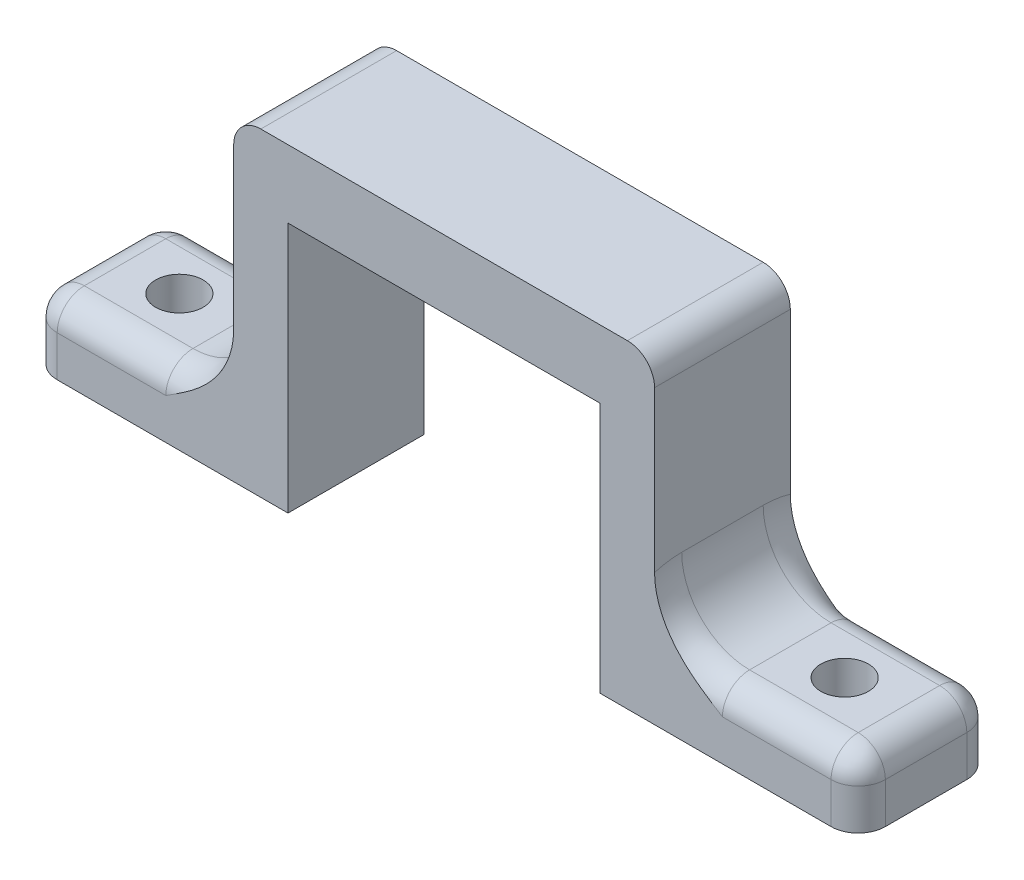
from build123d import *

# Parameters (mm, degrees)
SKETCH1_W           = 15
SKETCH1_H           = 10
SKETCH1_W_2         = 4
SKETCH1_W_3         = 23
BOSS_EXTRUDE1_DEPTH = 23.5
SKETCH1_3_W         = 23
SKETCH1_3_H         = 10
CUT_EXTRUDE1_DEPTH  = 18.5
CUT_EXTRUDE2_START  = 23.5
SKETCH1_4_W         = 15
SKETCH1_4_H         = 10
CUT_EXTRUDE2_DEPTH  = 18.5
FILLET1_R           = 2
FILLET2_R           = 2
FILLET3_R           = 5
CUT_EXTRUDE3_REACH  = 48.971
SKETCH2_R           = 1.75


with BuildPart() as part:
    # Sketch1 → Boss-Extrude1 (new body)
    with BuildSketch(Plane(origin=(0, 0, 0), x_dir=(1, 0, 0), z_dir=(0, 1, 0))):
        with Locations((-34.5, -5)):
            Rectangle(SKETCH1_W, SKETCH1_H)
        with Locations((-25, -5)):
            Rectangle(SKETCH1_W_2, SKETCH1_H)
        with Locations((-11.5, -5)):
            Rectangle(SKETCH1_W_3, SKETCH1_H)
        with Locations((2, -5)):
            Rectangle(SKETCH1_W_2, SKETCH1_H)
        with Locations((11.5, -5)):
            Rectangle(SKETCH1_W, SKETCH1_H)
    extrude(amount=BOSS_EXTRUDE1_DEPTH)

    # Sketch1<3> → Cut-Extrude1 (cut)
    with BuildSketch(Plane(origin=(0, 0, 0), x_dir=(1, 0, 0), z_dir=(0, 1, 0))):
        with Locations((-11.5, -5)):
            Rectangle(SKETCH1_3_W, SKETCH1_3_H)
    extrude(amount=CUT_EXTRUDE1_DEPTH, mode=Mode.SUBTRACT)

    # Sketch1<4> → Cut-Extrude2 (cut)
    with BuildSketch(Plane(origin=(0, 0, 0), x_dir=(1, 0, 0), z_dir=(0, 1, 0)).offset(CUT_EXTRUDE2_START)):
        with Locations((-34.5, -5)):
            Rectangle(SKETCH1_4_W, SKETCH1_4_H)
        with Locations((11.5, -5)):
            Rectangle(SKETCH1_4_W, SKETCH1_4_H)
    extrude(amount=-CUT_EXTRUDE2_DEPTH, mode=Mode.SUBTRACT)

    # Fillet1
    fillet1_edges = [part.edges().sort_by_distance(p)[0] for p in [
        (19, 2.5, 0),
        (19, 2.5, 10),
        (-42, 2.5, 10),
        (-42, 2.5, 0),
        (-27, 23.5, 5),
        (4, 23.5, 5),
    ]]
    fillet(fillet1_edges, radius=FILLET1_R)

    # Fillet2
    fillet2_edges = [part.edges().sort_by_distance(p)[0] for p in [
        (-33.5, 5, 0),
        (-33.5, 5, 10),
        (10.5, 5, 10),
        (10.5, 5, 0),
        (19, 5, 5),
        (18.414213562, 5, 9.414213562),
        (18.414213562, 5, 0.585786438),
        (-42, 5, 5),
        (-41.414213562, 5, 9.414213562),
        (-41.414213562, 5, 0.585786438),
    ]]
    fillet(fillet2_edges, radius=FILLET2_R)

    # Fillet3
    # the kernel refuses this fillet: 5 mm, written as the material it adds along each edge
    with BuildSketch(Plane(origin=(-27, 5, 8), x_dir=(-1, 0, 0), z_dir=(0, 0, -1))) as fillet3_piece_1:
        with BuildLine():
            CenterArc((FILLET3_R, FILLET3_R), FILLET3_R, 180, 90)
            Line((0, FILLET3_R), (0, 0))
            Line((0, 0), (FILLET3_R, 0))
        make_face()
    extrude(amount=6)
    with BuildSketch(Plane(origin=(4, 5, 8), x_dir=(1, 0, 0), z_dir=(0, 0, -1))) as fillet3_piece_2:
        with BuildLine():
            CenterArc((FILLET3_R, -FILLET3_R), FILLET3_R, 90, 90)
            Line((0, -FILLET3_R), (0, 0))
            Line((0, 0), (FILLET3_R, 0))
        make_face()
    extrude(amount=6)
    with BuildSketch(Plane(origin=(-27, 3, 8), x_dir=(0, 0.9999802608561372, -0.006283143965558846), z_dir=(0, 0.006283143965558846, 0.9999802608561372))) as fillet3_piece_3_section:
        with BuildLine():
            CenterArc((-2 - FILLET3_R, FILLET3_R), FILLET3_R, 270, 90)
            Line((-2 - FILLET3_R, 0), (-2, 0))
            Line((-2, 0), (-2, FILLET3_R))
        make_face()
    fillet3_piece_3 = revolve(axis=Axis((-27, 3, 8), (-1, 0, 0)), revolution_arc=359.64, mode=Mode.PRIVATE)
    fillet3_piece_3 = split(fillet3_piece_3, bisect_by=Plane(origin=(-28.84257052, 4.524977571, 10), z_dir=(0, 0, -1)), keep=Keep.TOP, mode=Mode.PRIVATE)
    fillet3_piece_3 = split(fillet3_piece_3, bisect_by=Plane(origin=(-28.84257052, 0, 9.524977571), z_dir=(0, 1, 0)), keep=Keep.TOP, mode=Mode.PRIVATE)
    add(fillet3_piece_3)
    with BuildSketch(Plane(origin=(4, 3, 8), x_dir=(0, 1, 0), z_dir=(0, 0, -1))) as fillet3_piece_4_section:
        with BuildLine():
            CenterArc((2 + FILLET3_R, FILLET3_R), FILLET3_R, 180, 90)
            Line((2 + FILLET3_R, 0), (2, 0))
            Line((2, 0), (2, FILLET3_R))
        make_face()
    fillet3_piece_4 = revolve(axis=Axis((4, 3, 8), (1, 0, 0)), revolution_arc=359.64, mode=Mode.PRIVATE)
    fillet3_piece_4 = split(fillet3_piece_4, bisect_by=Plane(origin=(5.842570594, 4.524977559, 10), z_dir=(0, 0, -1)), keep=Keep.TOP, mode=Mode.PRIVATE)
    fillet3_piece_4 = split(fillet3_piece_4, bisect_by=Plane(origin=(5.842570594, 0, 9.524977563), z_dir=(0, 1, 0)), keep=Keep.TOP, mode=Mode.PRIVATE)
    add(fillet3_piece_4)
    with BuildSketch(Plane(origin=(-27, 3, 2), x_dir=(0, 0.9999802608561372, 0.006283143965559623), z_dir=(0, 0.006283143965559623, -0.9999802608561372))) as fillet3_piece_5_section:
        with BuildLine():
            CenterArc((-2 - FILLET3_R, -FILLET3_R), FILLET3_R, 0, 90)
            Line((-2 - FILLET3_R, 0), (-2, 0))
            Line((-2, 0), (-2, -FILLET3_R))
        make_face()
    fillet3_piece_5 = revolve(axis=Axis((-27, 3, 2), (1, 0, 0)), revolution_arc=359.64, mode=Mode.PRIVATE)
    fillet3_piece_5 = split(fillet3_piece_5, bisect_by=Plane(origin=(-28.842570484, 4.524977653, 0), z_dir=(0, 0, 1)), keep=Keep.TOP, mode=Mode.PRIVATE)
    fillet3_piece_5 = split(fillet3_piece_5, bisect_by=Plane(origin=(-28.842570484, 0, 0.47502245), z_dir=(0, 1, 0)), keep=Keep.TOP, mode=Mode.PRIVATE)
    add(fillet3_piece_5)
    with BuildSketch(Plane(origin=(4, 3, 2), x_dir=(0, 1, 0), z_dir=(0, 0, 1))) as fillet3_piece_6_section:
        with BuildLine():
            CenterArc((2 + FILLET3_R, -FILLET3_R), FILLET3_R, 90, 90)
            Line((2, -FILLET3_R), (2, 0))
            Line((2, 0), (2 + FILLET3_R, 0))
        make_face()
    fillet3_piece_6 = revolve(axis=Axis((4, 3, 2), (-1, 0, 0)), revolution_arc=359.64, mode=Mode.PRIVATE)
    fillet3_piece_6 = split(fillet3_piece_6, bisect_by=Plane(origin=(4.944030812, 6.137069115, 0), z_dir=(0, 0, 1)), keep=Keep.TOP, mode=Mode.PRIVATE)
    fillet3_piece_6 = split(fillet3_piece_6, bisect_by=Plane(origin=(4.944030812, 0, 1.077199574), z_dir=(0, 1, 0)), keep=Keep.TOP, mode=Mode.PRIVATE)
    add(fillet3_piece_6)

    # Sketch2 → Cut-Extrude3 (cut, up to next)
    with BuildSketch(Plane(origin=(0, 5, 0), x_dir=(1, 0, 0), z_dir=(0, 1, 0)), mode=Mode.PRIVATE) as cut_extrude3_sk1:
        with Locations(Location((13, -5, 0), (0, 0, 270))):
            Circle(SKETCH2_R)
    cut_extrude3_tool1 = extrude(cut_extrude3_sk1.sketch, amount=-CUT_EXTRUDE3_REACH, mode=Mode.PRIVATE) & part.part
    # Sketch2 → Cut-Extrude3 (cut, up to next)
    with BuildSketch(Plane(origin=(0, 5, 0), x_dir=(1, 0, 0), z_dir=(0, 1, 0)), mode=Mode.PRIVATE) as cut_extrude3_sk2:
        with Locations(Location((-36, -5, 0), (0, 0, 270))):
            Circle(SKETCH2_R)
    cut_extrude3_tool2 = extrude(cut_extrude3_sk2.sketch, amount=-CUT_EXTRUDE3_REACH, mode=Mode.PRIVATE) & part.part
    add(cut_extrude3_tool1.solids().sort_by_distance((13, 5, 5))[0], mode=Mode.SUBTRACT)
    add(cut_extrude3_tool2.solids().sort_by_distance((-36, 5, 5))[0], mode=Mode.SUBTRACT)


solid = part.part
